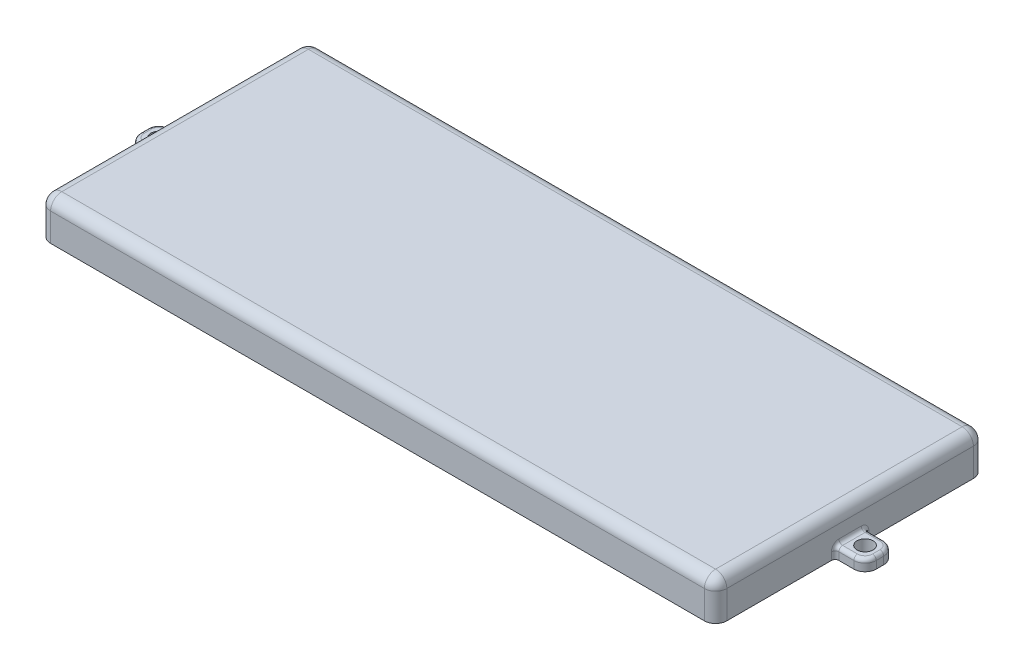
from build123d import *

# Parameters (mm, degrees)
SKETCH1_W           = 181
SKETCH1_H           = 72
BOSS_EXTRUDE1_DEPTH = 10.5
SHELL1_T            = -3
SKETCH2_W           = 8
SKETCH2_H           = 3
BOSS_EXTRUDE2_DEPTH = 8
SKETCH3_W           = 8
SKETCH3_H           = 3
BOSS_EXTRUDE3_DEPTH = 8
SKETCH4_R           = 2.15
CUT_EXTRUDE1_DEPTH  = 8
SKETCH5_R           = 2.15
CUT_EXTRUDE2_DEPTH  = 8
FILLET1_R           = 3
FILLET2_R           = 1


with BuildPart() as part:
    # Sketch1 → Boss-Extrude1 (new body)
    with BuildSketch(Plane(origin=(0, 0, 0), x_dir=(1, 0, 0), z_dir=(0, 1, 0))):
        Rectangle(SKETCH1_W, SKETCH1_H)
    extrude(amount=BOSS_EXTRUDE1_DEPTH)

    # Shell1
    shell1_openings = [part.faces().sort_by_distance(p)[0] for p in [
        (0, 0, 0),
    ]]
    offset(amount=SHELL1_T, openings=shell1_openings, kind=Kind.INTERSECTION)

    # Sketch2 → Boss-Extrude2 (add)
    with BuildSketch(Plane.ZY.offset(90.5)):
        with Locations((0, 1.5)):
            Rectangle(SKETCH2_W, SKETCH2_H)
    extrude(amount=BOSS_EXTRUDE2_DEPTH)

    # Sketch3 → Boss-Extrude3 (add)
    with BuildSketch(Plane(origin=(90.5, 0, 0), x_dir=(0, 0, -1), z_dir=(1, 0, 0))):
        with Locations((0, 1.5)):
            Rectangle(SKETCH3_W, SKETCH3_H)
    extrude(amount=BOSS_EXTRUDE3_DEPTH)

    # Sketch4 → Cut-Extrude1 (cut)
    with BuildSketch(Plane(origin=(0, 3, 0), x_dir=(1, 0, 0), z_dir=(0, 1, 0))):
        with Locations((-94.5, 0)):
            Circle(SKETCH4_R)
    extrude(amount=-CUT_EXTRUDE1_DEPTH, mode=Mode.SUBTRACT)

    # Sketch5 → Cut-Extrude2 (cut)
    with BuildSketch(Plane(origin=(0, 3, 0), x_dir=(1, 0, 0), z_dir=(0, 1, 0))):
        with Locations((94.5, 0)):
            Circle(SKETCH5_R)
    extrude(amount=-CUT_EXTRUDE2_DEPTH, mode=Mode.SUBTRACT)

    # Fillet1
    fillet1_edges = [part.edges().sort_by_distance(p)[0] for p in [
        (-87.5, 3.75, -33),
        (-87.5, 3.75, 33),
        (87.5, 3.75, -33),
        (87.5, 3.75, 33),
        (98.5, 1.5, 4),
        (98.5, 1.5, -4),
        (90.5, 5.25, -36),
        (90.5, 5.25, 36),
        (-90.5, 5.25, -36),
        (-90.5, 5.25, 36),
        (-98.5, 1.5, -4),
        (-98.5, 1.5, 4),
        (0, 10.5, 36),
        (-90.5, 10.5, 0),
        (0, 10.5, -36),
        (90.5, 10.5, 0),
        (87.5, 7.5, 0),
        (0, 7.5, -33),
        (-87.5, 7.5, 0),
        (0, 7.5, 33),
    ]]
    fillet(fillet1_edges, radius=FILLET1_R)

    # Fillet2
    fillet2_edges = [part.edges().sort_by_distance(p)[0] for p in [
        (-90.5, 1.5, -4),
        (-90.5, 3, 0),
        (-90.5, 1.5, 4),
        (90.5, 1.5, 4),
        (90.5, 1.5, -4),
        (90.5, 3, 0),
        (93, 3, 4),
        (93, 3, -4),
        (97.621320344, 3, -3.121320344),
        (98.5, 3, 0),
        (-93, 3, 4),
        (-97.621320344, 3, 3.121320344),
        (-93, 3, -4),
        (-97.621320344, 3, -3.121320344),
        (97.621320344, 3, 3.121320344),
        (-98.5, 3, 0),
    ]]
    fillet(fillet2_edges, radius=FILLET2_R)


solid = part.part
